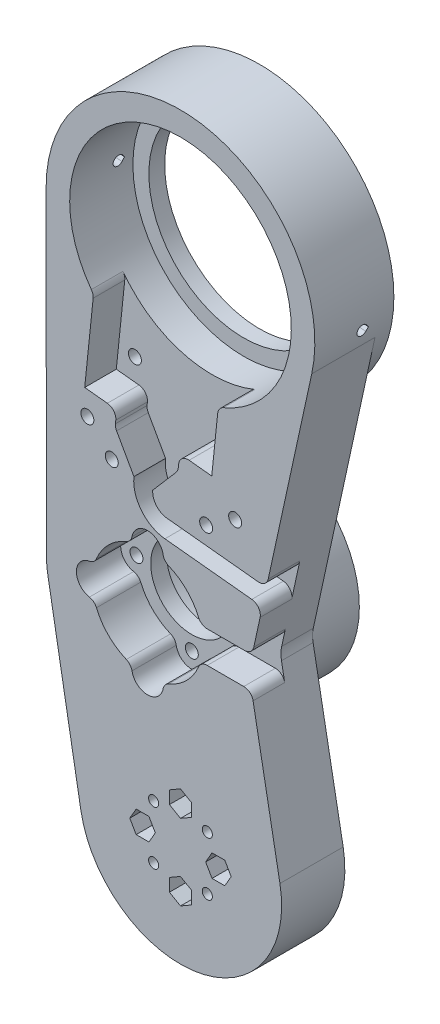
from build123d import *

# Parameters (mm, degrees)
MAIN_R                    = 25
MAIN_R_2                  = 35.05
MAIN_R_3                  = 2.05
BOSS_EXTRUDE10_DEPTH      = 20
BOSS_EXTRUDE11_START      = 6
MAIN_18_R                 = 25
BOSS_EXTRUDE11_DEPTH      = 14
BOSS_EXTRUDE12_START      = 1
MAIN_19_R                 = 25
MAIN_19_R_2               = 2.05
MAIN_19_R_3               = 13
BOSS_EXTRUDE12_DEPTH      = 5
BOSS_EXTRUDE13_START      = -15
MAIN_20_R                 = 32
MAIN_20_R_2               = 25
BOSS_EXTRUDE13_DEPTH      = 15
BOSS_EXTRUDE14_START      = -5
MAIN_21_R                 = 42.5
MAIN_21_R_2               = 35.05
MAIN_21_R_3               = 30
BOSS_EXTRUDE14_DEPTH      = 5
MAIN_24_R                 = 16.25
CUT_EXTRUDE1_DEPTH        = 3.5
SKETCH1_R                 = 2.05
SKETCH1_R_2               = 1.6
CUT_EXTRUDE2_DEPTH        = 7
CUT_EXTRUDE3_OUTLINE_R    = 1.6
CUT_EXTRUDE3_DEPTH        = 13
CUT_EXTRUDE4_START        = -10
CUT_EXTRUDE4_DEPTH        = 10
CUT_EXTRUDE5_START        = -10
SKETCH2_12_R              = 2.05
CUT_EXTRUDE5_DEPTH        = 7
CUT_EXTRUDE6_START        = -17
SKETCH2_13_R              = 1.6
CUT_EXTRUDE6_DEPTH        = 7
BOSS_EXTRUDE15_DEPTH      = 10
INTERSECT1_START          = 10
INTERSECT1_DEPTH          = 10
FILLET1_R                 = 3
CUT_EXTRUDE8_DEPTH        = 10
FILLET3_R                 = 3
FILLET4_R                 = 3.25
CUT_EXTRUDE10_DEPTH       = 13
CUT_EXTRUDE11_REACH       = 209.298
SKETCH6_R                 = 1.6
CUT_EXTRUDE12_START       = -2.75
CUT_EXTRUDE12_OUTLINE_W   = 5.5
CUT_EXTRUDE12_OUTLINE_H   = 3.5
CUT_EXTRUDE12_DEPTH       = 5.5
CUT_EXTRUDE12_START_2     = -14.75
CUT_EXTRUDE12_2_OUTLINE_W = 5.5
CUT_EXTRUDE12_2_OUTLINE_H = 3.5
CUT_EXTRUDE12_2_DEPTH     = 5.5
CUT_EXTRUDE12_START_3     = 9.25
CUT_EXTRUDE12_3_OUTLINE_W = 5.5
CUT_EXTRUDE12_3_OUTLINE_H = 3.5
CUT_EXTRUDE12_3_DEPTH     = 5.5
SKETCH4_R                 = 2.05
CUT_EXTRUDE13_DEPTH       = 7
CUT_EXTRUDE14_OUTLINE_R   = 1.6
CUT_EXTRUDE14_DEPTH       = 13
FILLET5_R                 = 10
CUT_EXTRUDE15_START       = -12.6
CUT_EXTRUDE15_DEPTH       = 12.6
CUT_EXTRUDE16_DEPTH       = 220.84129926
CUT_EXTRUDE16_DEPTH_BACK  = 220.84129926


# Read off the part's stored shape, not the designer's step: Cut-Extrude3, Intersect1, Cut-Extrude12, Cut-Extrude14
with BuildPart() as part:
    # Main → Boss-Extrude10 (new body)
    with BuildSketch(Plane(origin=(0, 0, 0), x_dir=(0, 1, 0), z_dir=(0, 0, 1))):
        with BuildLine():
            ThreePointArc((-5.556741685, 31.513848096), (-31.488658149, -5.697754643), (5.838653427, -31.462837224))
            Line((5.838653427, -31.462837224), (59.088465181, -21.58110934))
            Line((59.088465181, -21.58110934), (150.490078089, -41.523179331))
            ThreePointArc((150.490078089, -41.523179331), (201.806560384, -4.538974444), (159.515320714, 42.499986147))
            Line((159.515320714, 42.499986147), (59.062628257, 42.41888023))
            ThreePointArc((59.062628257, 42.41888023), (56.286612336, 42.295992483), (53.531723495, 41.932738756))
            Line((53.531723495, 41.932738756), (-5.556741685, 31.513848096))
        make_face()
        with Locations(Location((59.088465181, 10.41889066, 0), (0, 0, 270))):
            Circle(MAIN_R, mode=Mode.SUBTRACT)
        with Locations(Location((159.549635378, 0, 0), (0, 0, 270))):
            Circle(MAIN_R_2, mode=Mode.SUBTRACT)
        with Locations(Location((0, 12, 0), (0, 0, 270))):
            Circle(MAIN_R_3, mode=Mode.SUBTRACT)
        with Locations(Location((0, -12, 0), (0, 0, 270))):
            Circle(MAIN_R_3, mode=Mode.SUBTRACT)
        with Locations(Location((-12, 0, 0), (0, 0, 270))):
            Circle(MAIN_R_3, mode=Mode.SUBTRACT)
        with Locations(Location((12, 0, 0), (0, 0, 270))):
            Circle(MAIN_R_3, mode=Mode.SUBTRACT)
    extrude(amount=BOSS_EXTRUDE10_DEPTH)

    # Main<18> → Boss-Extrude11 (add)
    with BuildSketch(Plane(origin=(0, 0, 0), x_dir=(0, 1, 0), z_dir=(0, 0, 1)).offset(BOSS_EXTRUDE11_START)):
        with Locations(Location((59.088465181, 10.41889066, 0), (0, 0, 270))):
            Circle(MAIN_18_R)
        with BuildLine():
            ThreePointArc((64.037181774, 27.204604946), (71.462833851, 22.793259331), (75.874179466, 15.367607253))
            ThreePointArc((75.874179466, 15.367607253), (81.588465181, 10.41889066), (75.874179466, 5.470174067))
            ThreePointArc((75.874179466, 5.470174067), (71.462833851, -1.955478011), (64.037181774, -6.366823626))
            ThreePointArc((64.037181774, -6.366823626), (59.088465181, -12.08110934), (54.139748588, -6.366823626))
            ThreePointArc((54.139748588, -6.366823626), (46.71409651, -1.955478011), (42.302750895, 5.470174067))
            ThreePointArc((42.302750895, 5.470174067), (36.588465181, 10.41889066), (42.302750895, 15.367607253))
            ThreePointArc((42.302750895, 15.367607253), (46.71409651, 22.793259331), (54.139748588, 27.204604946))
            ThreePointArc((54.139748588, 27.204604946), (59.088465181, 32.91889066), (64.037181774, 27.204604946))
        make_face(mode=Mode.SUBTRACT)
    extrude(amount=BOSS_EXTRUDE11_DEPTH)

    # Main<19> → Boss-Extrude12 (add)
    with BuildSketch(Plane(origin=(0, 0, 0), x_dir=(0, 1, 0), z_dir=(0, 0, 1)).offset(BOSS_EXTRUDE12_START)):
        with Locations(Location((59.088465181, 10.41889066, 0), (0, 0, 270))):
            Circle(MAIN_19_R)
        with Locations(Location((59.088465181, -7.08110934, 0), (0, 0, 270))):
            Circle(MAIN_19_R_2, mode=Mode.SUBTRACT)
        with Locations(Location((41.588465181, 10.41889066, 0), (0, 0, 270))):
            Circle(MAIN_19_R_2, mode=Mode.SUBTRACT)
        with Locations(Location((59.088465181, 10.41889066, 0), (0, 0, 270))):
            Circle(MAIN_19_R_3, mode=Mode.SUBTRACT)
        with Locations(Location((76.588465181, 10.41889066, 0), (0, 0, 270))):
            Circle(MAIN_19_R_2, mode=Mode.SUBTRACT)
        with Locations(Location((59.088465181, 27.91889066, 0), (0, 0, 270))):
            Circle(MAIN_19_R_2, mode=Mode.SUBTRACT)
    extrude(amount=BOSS_EXTRUDE12_DEPTH)

    # Main<20> → Boss-Extrude13 (add)
    with BuildSketch(Plane(origin=(0, 0, 0), x_dir=(0, 1, 0), z_dir=(0, 0, 1)).offset(BOSS_EXTRUDE13_START)):
        with Locations(Location((59.088465181, 10.41889066, 0), (0, 0, 270))):
            Circle(MAIN_20_R)
        with Locations(Location((59.088465181, 10.41889066, 0), (0, 0, 270))):
            Circle(MAIN_20_R_2, mode=Mode.SUBTRACT)
    extrude(amount=BOSS_EXTRUDE13_DEPTH)

    # Main<21> → Boss-Extrude14 (add)
    # profile 1 of 2: a face of its own
    with BuildSketch(Plane(origin=(0, 0, 0), x_dir=(0, 1, 0), z_dir=(0, 0, 1)).offset(BOSS_EXTRUDE14_START)):
        with Locations(Location((159.549635378, 0, 0), (0, 0, 90.046260838))):
            Circle(MAIN_21_R)
        with Locations(Location((159.549635378, 0, 0), (0, 0, 270))):
            Circle(MAIN_21_R_2, mode=Mode.SUBTRACT)
    # profile 2 of 2: a face of its own
    with BuildSketch(Plane(origin=(0, 0, 0), x_dir=(0, 1, 0), z_dir=(0, 0, 1)).offset(BOSS_EXTRUDE14_START)):
        with Locations(Location((159.549635378, 0, 0), (0, 0, 270))):
            Circle(MAIN_21_R_2)
        with Locations(Location((159.549635378, 0, 0), (0, 0, 270))):
            Circle(MAIN_21_R_3, mode=Mode.SUBTRACT)
    extrude(amount=BOSS_EXTRUDE14_DEPTH)

    # Main<24> → Cut-Extrude1 (cut)
    with BuildSketch(Plane(origin=(0, 0, 0), x_dir=(0, 1, 0), z_dir=(0, 0, 1))):
        with Locations(Location((0, 0, 0), (0, 0, 270))):
            Circle(MAIN_24_R)
    extrude(amount=CUT_EXTRUDE1_DEPTH, mode=Mode.SUBTRACT)

    # Sketch1 → Cut-Extrude2 (cut)
    # profile 1 of 4: a face of its own
    with BuildSketch(Plane.XY.offset(20)):
        with Locations((-29.460911372, 103.288594674)):
            Circle(SKETCH1_R)
        with Locations((-29.460911372, 103.288594674)):
            Circle(SKETCH1_R_2, mode=Mode.SUBTRACT)
    # profile 2 of 4: a face of its own
    with BuildSketch(Plane.XY.offset(20)):
        with Locations((-29.460911372, 103.288594674)):
            Circle(SKETCH1_R_2)
    # profile 3 of 4: a face of its own
    with BuildSketch(Plane.XY.offset(20)):
        with Locations((17.288346046, 98.44020001)):
            Circle(SKETCH1_R)
        with Locations((17.288346046, 98.44020001)):
            Circle(SKETCH1_R_2, mode=Mode.SUBTRACT)
    # profile 4 of 4: a face of its own
    with BuildSketch(Plane.XY.offset(20)):
        with Locations((17.288346046, 98.44020001)):
            Circle(SKETCH1_R_2)
    extrude(amount=-CUT_EXTRUDE2_DEPTH, mode=Mode.SUBTRACT)

    # Cut-Extrude3 outline → Cut-Extrude3 (cut)
    with BuildSketch(Plane.XY):
        with Locations((17.288346046, 98.44020001)):
            Circle(CUT_EXTRUDE3_OUTLINE_R)
        with Locations((-29.460911372, 103.288594674)):
            Circle(CUT_EXTRUDE3_OUTLINE_R)
    extrude(amount=CUT_EXTRUDE3_DEPTH, mode=Mode.SUBTRACT)

    # Sketch2 → Cut-Extrude4 (cut)
    with BuildSketch(Plane.XY.offset(20).offset(CUT_EXTRUDE4_START)):
        with BuildLine():
            Line((-29.586429257, 117.712405115), (-27.501094437, 137.819649074))
            ThreePointArc((-27.501094437, 137.819649074), (-9.587027237, 125.836264013), (11.952039535, 126.600413066))
            Line((11.952039535, 126.600413066), (10.598038822, 113.544848851))
            Line((10.598038822, 113.544848851), (9.886253223, 106.681659996))
            Line((9.886253223, 106.681659996), (-0.259330302, 107.733864795))
            Line((-0.259330302, 107.733864795), (-20.152631332, 109.797011461))
            Line((-20.152631332, 109.797011461), (-30.298214856, 110.84921626))
            Line((-30.298214856, 110.84921626), (-29.586429257, 117.712405115))
        make_face()
    extrude(amount=CUT_EXTRUDE4_DEPTH, mode=Mode.SUBTRACT)

    # Sketch2<12> → Cut-Extrude5 (cut)
    with BuildSketch(Plane.XY.offset(20).offset(CUT_EXTRUDE5_START)):
        with Locations((-24.414170989, 117.175986982)):
            Circle(SKETCH2_12_R)
        with Locations((5.425780554, 114.081266984)):
            Circle(SKETCH2_12_R)
    extrude(amount=-CUT_EXTRUDE5_DEPTH, mode=Mode.SUBTRACT)

    # Sketch2<13> → Cut-Extrude6 (cut)
    with BuildSketch(Plane.XY.offset(20).offset(CUT_EXTRUDE6_START)):
        with Locations((-24.414170989, 117.175986982)):
            Circle(SKETCH2_13_R)
        with Locations((5.425780554, 114.081266984)):
            Circle(SKETCH2_13_R)
    extrude(amount=-CUT_EXTRUDE6_DEPTH, mode=Mode.SUBTRACT)


with BuildPart() as body_2:
    # Sketch3 → Boss-Extrude15 (new body)
    with BuildSketch(Plane.XY.offset(20)):
        with BuildLine():
            Line((-0.259330302, 107.733864795), (-20.152631332, 109.797011461))
            Line((-20.152631332, 109.797011461), (-20.668417998, 104.823686203))
            Line((-20.668417998, 104.823686203), (-14.730087986, 94.218257585))
            ThreePointArc((-14.730087986, 94.218257585), (-11.412187952, 96.82600169), (-8.769345662, 93.535990356))
            ThreePointArc((-8.769345662, 93.535990356), (-8.772457879, 93.505043934), (-8.775377534, 93.474078752))
            Line((-8.775377534, 93.474078752), (-0.775116969, 102.760539538))
            Line((-0.775116969, 102.760539538), (-0.259330302, 107.733864795))
        make_face()
        with BuildLine():
            ThreePointArc((-8.769345662, 93.535990356), (-11.412187952, 96.82600169), (-14.730087986, 94.218257585))
            ThreePointArc((-14.730087986, 94.218257585), (-14.73388015, 94.186615219), (-14.73733597, 94.154934356))
            ThreePointArc((-14.73733597, 94.154934356), (-12.335074585, 86.085901007), (-4.93075107, 82.078888124))
            ThreePointArc((-4.93075107, 82.078888124), (-1.637283916, 84.753411278), (-4.311807071, 88.046878433))
            ThreePointArc((-4.311807071, 88.046878433), (-7.657726913, 89.84416483), (-8.775377534, 93.474078752))
            ThreePointArc((-8.775377534, 93.474078752), (-8.772457879, 93.505043934), (-8.769345662, 93.535990356))
        make_face()
        with BuildLine():
            Line((27.186542959, 84.780164892), (-4.311807071, 88.046878433))
            ThreePointArc((-4.311807071, 88.046878433), (-1.637283916, 84.753411278), (-4.93075107, 82.078888124))
            Line((-4.93075107, 82.078888124), (25.899558705, 78.881457455))
            Line((25.899558705, 78.881457455), (27.186542959, 84.780164892))
        make_face()
    extrude(amount=-BOSS_EXTRUDE15_DEPTH)


with BuildPart() as intersect1_tool:
    # Intersect1 outline → Intersect1 (new body)
    with BuildSketch(Plane.XY.offset(INTERSECT1_START)):
        with BuildLine():
            Line((-4.93075107, 82.078888124), (25.899558705, 78.881457455))
            Line((25.899558705, 78.881457455), (27.186542959, 84.780164892))
            Line((27.186542959, 84.780164892), (-4.311807071, 88.046878433))
            ThreePointArc((-4.311807071, 88.046878433), (-7.657726913, 89.844164831), (-8.775377534, 93.474078752))
            Line((-8.775377534, 93.474078752), (-0.775116969, 102.760539538))
            Line((-0.775116969, 102.760539538), (-0.259330302, 107.733864795))
            Line((-0.259330302, 107.733864795), (-20.152631332, 109.797011461))
            Line((-20.152631332, 109.797011461), (-20.668417998, 104.823686203))
            Line((-20.668417998, 104.823686203), (-14.730087986, 94.218257585))
            ThreePointArc((-14.730087986, 94.218257585), (-14.73388015, 94.186615219), (-14.73733597, 94.154934356))
            ThreePointArc((-14.73733597, 94.154934356), (-12.335074585, 86.085901007), (-4.93075107, 82.078888124))
        make_face()
    extrude(amount=INTERSECT1_DEPTH)


with BuildPart() as part_1:
    add(part.part)

    # Intersect1: cut by intersect1_tool
    add(intersect1_tool.part, mode=Mode.SUBTRACT)

    # Fillet1
    fillet1_edges = [part_1.edges().sort_by_distance(p)[0] for p in [
        (-27.501094437, 137.819649074, 15),
        (11.952039535, 126.600413066, 15),
        (-0.259330302, 107.733864795, 15),
        (25.899558705, 78.881457455, 15),
        (27.186542959, 84.780164892, 15),
        (-20.152631332, 109.797011461, 15),
        (-20.668417998, 104.823686203, 15),
        (-0.775116969, 102.760539538, 15),
    ]]
    fillet(fillet1_edges, radius=FILLET1_R)

    # Sketch5 → Cut-Extrude8 (cut)
    with BuildSketch(Plane.XY.offset(20)):
        Polygon((22.672012955, 64.088465181), (21.58110934, 59.088465181), (22.508974393, 54.088465181), (5.08110934, 54.088465181), (5.08110934, 64.088465181), align=None)
    extrude(amount=-CUT_EXTRUDE8_DEPTH, mode=Mode.SUBTRACT)

    # Fillet3
    # the kernel refuses this fillet: 3 mm, written as the material it takes off along each edge
    with BuildSketch(Plane(origin=(-15.367607253, 75.874179466, 6), x_dir=(0.018092404043588525, 0.999836319062237, 0), z_dir=(0, 0, 1)), Plane(origin=(-5.470174067, 42.302750895, 6), x_dir=(-0.018092404043595627, -0.9998363190622368, 0), z_dir=(0, 0, 1)), Plane(origin=(-27.204604946, 54.139748588, 6), x_dir=(-0.9998363190622368, 0.018092404043601663, 0), z_dir=(0, 0, 1))) as fillet3_piece_1:
        with BuildLine():
            CenterArc((2.089627747, 2.960990062), FILLET3_R, 203.616579082, 57.133535261)
            ThreePointArc((-0.659112793, 1.75914754), (-0.305934486, 0.888424365), (0, 0))
            ThreePointArc((0, 0), (0.803702979, 0.065016563), (1.607405959, 0))
        make_face()
    extrude(amount=18.696427991, mode=Mode.SUBTRACT)
    with BuildSketch(Plane(origin=(-5.470174067, 75.874179466, 6), x_dir=(0.9426230632930025, -0.3338588931691295, 0), z_dir=(0, 0, 1)), Plane(origin=(-15.367607253, 42.302750895, 6), x_dir=(-0.9426230632930039, 0.3338588931691254, 0), z_dir=(0, 0, 1)), Plane(origin=(-27.204604946, 64.037181774, 6), x_dir=(0.33385889316913303, 0.9426230632930012, 0), z_dir=(0, 0, 1))) as fillet3_piece_2:
        with BuildLine():
            CenterArc((2.039591585, 2.995675622), FILLET3_R, 209.789723377, 57.133535261)
            ThreePointArc((-0.563972147, 1.505220693), (-0.221102713, 0.775421964), (0, 0))
            ThreePointArc((0, 0), (0.939285598, 0.025225536), (1.878571196, 0))
        make_face()
    extrude(amount=18.696427991, mode=Mode.SUBTRACT)
    with BuildSketch(Plane(origin=(6.351619171, 54.088465181, 25.260190642), x_dir=(-0.33850165532610416, -0.9409657960529104, 0), z_dir=(0, 0, -1))) as fillet3_piece_3:
        with BuildLine():
            CenterArc((2.110664092, -2.995368756), FILLET3_R, 93.184063487, 67.030323428)
            Line((-0.712233296, -1.97986379), (0, 0))
            ThreePointArc((0, 0), (0.972016358, -0.02701559), (1.944032717, 0))
        make_face()
    extrude(amount=15.260190642, mode=Mode.SUBTRACT)
    with BuildSketch(Plane(origin=(6.351619171, 64.088465181, 25.260190642), x_dir=(1, 0, 0), z_dir=(0, 0, -1))) as fillet3_piece_4:
        with BuildLine():
            CenterArc((2.104076257, -3), FILLET3_R, 90, 67.030323428)
            ThreePointArc((-0.658058293, -1.829268293), (-0.3036084, -0.923778968), (0, 0))
            Line((0, 0), (2.104076257, 0))
        make_face()
    extrude(amount=15.260190642, mode=Mode.SUBTRACT)
    with BuildSketch(Plane(origin=(22.508974393, 54.088465181, 26.236249385), x_dir=(-1, 0, 0), z_dir=(0, 0, -1))) as fillet3_piece_5:
        with BuildLine():
            CenterArc((FILLET3_R * 0.831499918045, -FILLET3_R), FILLET3_R, 90, 79.487040481)
            Line((-FILLET3_R * 0.151713745192, -FILLET3_R * 0.817542080402), (0, 0))
            Line((0, 0), (FILLET3_R * 0.831499918045, 0))
        make_face()
    extrude(amount=16.236249385, mode=Mode.SUBTRACT)
    with BuildSketch(Plane(origin=(22.672012955, 64.088465181, 26.040079887), x_dir=(-1, 0, 0), z_dir=(0, 0, -1))) as fillet3_piece_6:
        with BuildLine():
            CenterArc((FILLET3_R * 0.805343984975, FILLET3_R), FILLET3_R, 192.307955921, 77.692044079)
            Line((-FILLET3_R * 0.171671999276, FILLET3_R * 0.786833946142), (0, 0))
            Line((0, 0), (FILLET3_R * 0.805343984975, 0))
        make_face()
    extrude(amount=16.040079887, mode=Mode.SUBTRACT)

    # Fillet4
    fillet4_edges = [part_1.edges().sort_by_distance(p)[0] for p in [
        (6.366823626, 54.139748588, 8),
        (6.366823626, 64.037181774, 8),
    ]]
    fillet(fillet4_edges, radius=FILLET4_R)

    # Sketch7 → Cut-Extrude10 (cut)
    with BuildSketch(Plane.XY.offset(20)):
        Polygon((0, 7.958548116), (3.5, 9.979274058), (3.5, 14.020725942), (0, 16.041451884), (-3.5, 14.020725942), (-3.5, 9.979274058), align=None)
        Polygon((-7.958548116, 0), (-9.979274058, 3.5), (-14.020725942, 3.5), (-16.041451884, 0), (-14.020725942, -3.5), (-9.979274058, -3.5), align=None)
        Polygon((7.958548116, 0), (9.979274058, -3.5), (14.020725942, -3.5), (16.041451884, 0), (14.020725942, 3.5), (9.979274058, 3.5), align=None)
        Polygon((0, -7.958548116), (-3.5, -9.979274058), (-3.5, -14.020725942), (0, -16.041451884), (3.5, -14.020725942), (3.5, -9.979274058), align=None)
    extrude(amount=-CUT_EXTRUDE10_DEPTH, mode=Mode.SUBTRACT)

    # Sketch6 → Cut-Extrude11 (cut, up to next)
    with BuildSketch(Plane(origin=(0, 0, 3.5), x_dir=(1, 0, 0), z_dir=(0, 0, -1)), mode=Mode.PRIVATE) as cut_extrude11_sk1:
        with Locations(Location((8.485281374, -8.485281374, 0), (0, 0, 180))):
            Circle(SKETCH6_R)
    cut_extrude11_tool1 = extrude(cut_extrude11_sk1.sketch, amount=-CUT_EXTRUDE11_REACH, mode=Mode.PRIVATE) & part_1.part
    # Sketch6 → Cut-Extrude11 (cut, up to next)
    with BuildSketch(Plane(origin=(0, 0, 3.5), x_dir=(1, 0, 0), z_dir=(0, 0, -1)), mode=Mode.PRIVATE) as cut_extrude11_sk2:
        with Locations(Location((-8.485281374, -8.485281374, 0), (0, 0, 180))):
            Circle(SKETCH6_R)
    cut_extrude11_tool2 = extrude(cut_extrude11_sk2.sketch, amount=-CUT_EXTRUDE11_REACH, mode=Mode.PRIVATE) & part_1.part
    # Sketch6 → Cut-Extrude11 (cut, up to next)
    with BuildSketch(Plane(origin=(0, 0, 3.5), x_dir=(1, 0, 0), z_dir=(0, 0, -1)), mode=Mode.PRIVATE) as cut_extrude11_sk3:
        with Locations(Location((-8.485281374, 8.485281374, 0), (0, 0, 180))):
            Circle(SKETCH6_R)
    cut_extrude11_tool3 = extrude(cut_extrude11_sk3.sketch, amount=-CUT_EXTRUDE11_REACH, mode=Mode.PRIVATE) & part_1.part
    # Sketch6 → Cut-Extrude11 (cut, up to next)
    with BuildSketch(Plane(origin=(0, 0, 3.5), x_dir=(1, 0, 0), z_dir=(0, 0, -1)), mode=Mode.PRIVATE) as cut_extrude11_sk4:
        with Locations(Location((8.485281374, 8.485281374, 0), (0, 0, 180))):
            Circle(SKETCH6_R)
    cut_extrude11_tool4 = extrude(cut_extrude11_sk4.sketch, amount=-CUT_EXTRUDE11_REACH, mode=Mode.PRIVATE) & part_1.part
    add(cut_extrude11_tool1.solids().sort_by_distance((8.485281, 8.485281, 3.5))[0], mode=Mode.SUBTRACT)
    add(cut_extrude11_tool2.solids().sort_by_distance((-8.485281, 8.485281, 3.5))[0], mode=Mode.SUBTRACT)
    add(cut_extrude11_tool3.solids().sort_by_distance((-8.485281, -8.485281, 3.5))[0], mode=Mode.SUBTRACT)
    add(cut_extrude11_tool4.solids().sort_by_distance((8.485281, -8.485281, 3.5))[0], mode=Mode.SUBTRACT)

    # Cut-Extrude12 outline → Cut-Extrude12 (cut)
    with BuildSketch(Plane(origin=(0, 0, 0), x_dir=(0.7071067811865474, -0.7071067811865477, 0), z_dir=(0.7071067811865476, 0.7071067811865476, 0)).offset(CUT_EXTRUDE12_START)):
        with Locations((12, -5.25)):
            Rectangle(CUT_EXTRUDE12_OUTLINE_W, CUT_EXTRUDE12_OUTLINE_H)
        with Locations((-12, -5.25)):
            Rectangle(CUT_EXTRUDE12_OUTLINE_W, CUT_EXTRUDE12_OUTLINE_H)
    extrude(amount=CUT_EXTRUDE12_DEPTH, mode=Mode.SUBTRACT)

    # Cut-Extrude12 2 outline → Cut-Extrude12 2 (cut)
    with BuildSketch(Plane(origin=(0, 0, 0), x_dir=(0.7071067811865474, -0.7071067811865477, 0), z_dir=(0.7071067811865476, 0.7071067811865476, 0)).offset(CUT_EXTRUDE12_START_2)):
        with Locations((0, -5.25)):
            Rectangle(CUT_EXTRUDE12_2_OUTLINE_W, CUT_EXTRUDE12_2_OUTLINE_H)
    extrude(amount=CUT_EXTRUDE12_2_DEPTH, mode=Mode.SUBTRACT)

    # Cut-Extrude12 3 outline → Cut-Extrude12 3 (cut)
    with BuildSketch(Plane(origin=(0, 0, 0), x_dir=(0.7071067811865474, -0.7071067811865477, 0), z_dir=(0.7071067811865476, 0.7071067811865476, 0)).offset(CUT_EXTRUDE12_START_3)):
        with Locations((0, -5.25)):
            Rectangle(CUT_EXTRUDE12_3_OUTLINE_W, CUT_EXTRUDE12_3_OUTLINE_H)
    extrude(amount=CUT_EXTRUDE12_3_DEPTH, mode=Mode.SUBTRACT)

    # Sketch4 → Cut-Extrude13 (cut)
    with BuildSketch(Plane.XY.offset(20)):
        with Locations((-21.728359768, 95.449101981)):
            Circle(SKETCH4_R)
        with Locations((8.111591776, 92.354381983)):
            Circle(SKETCH4_R)
    extrude(amount=-CUT_EXTRUDE13_DEPTH, mode=Mode.SUBTRACT)

    # Cut-Extrude14 outline → Cut-Extrude14 (cut)
    with BuildSketch(Plane.XY):
        with Locations((-21.728359768, 95.449101981)):
            Circle(CUT_EXTRUDE14_OUTLINE_R)
        with Locations((8.111591776, 92.354381983)):
            Circle(CUT_EXTRUDE14_OUTLINE_R)
    extrude(amount=CUT_EXTRUDE14_DEPTH, mode=Mode.SUBTRACT)

    # Fillet5
    # the kernel refuses this fillet: 10 mm, written as the material it adds along each edge
    with BuildSketch(Plane(origin=(21.58110934, 59.088465181, 0), x_dir=(0.2131660538584211, 0.9770159842512449, 0), z_dir=(0, 0, 1))) as fillet5_piece_1:
        with BuildLine():
            CenterArc((FILLET5_R * 0.201825318765, -FILLET5_R), FILLET5_R, 90, 22.82091544)
            Line((-FILLET5_R * 0.186026761828, -FILLET5_R * 0.0782783697991), (0, 0))
            Line((0, 0), (FILLET5_R * 0.201825318765, 0))
        make_face()
    extrude(amount=10)

    # Sketch11 → Cut-Extrude15 (cut)
    with BuildSketch(Plane(origin=(0, 0, -5), x_dir=(1, 0, 0), z_dir=(0, 0, -1)).offset(CUT_EXTRUDE15_START)):
        Polygon((37.498115689, -152.745128065), (38.096428222, -158.514185363), (40.085758325, -158.307870697), (39.487445792, -152.538813398), align=None)
        Polygon((-40.085758325, -160.79140006), (-39.487445792, -166.560457358), (-37.498115689, -166.354142691), (-38.096428222, -160.585085393), align=None)
    extrude(amount=CUT_EXTRUDE15_DEPTH, mode=Mode.SUBTRACT)

    # Sketch12 → Cut-Extrude16 (cut, two sides: drawn at the far end of the back side and taken through both)
    with BuildSketch(Plane(origin=(-54.168180468, 5.617815803, 0), x_dir=(-0.10315733326748301, -0.9946650514586011, 0), z_dir=(-0.9946650514586011, 0.10315733326748301, 0)).offset(-CUT_EXTRUDE16_DEPTH_BACK)):
        with BuildLine():
            Line((-158.698446284, 2.85), (-157.738446284, 3.57))
            ThreePointArc((-157.738446284, 3.57), (-158.698446284, 6.45), (-159.658446284, 3.57))
            Line((-159.658446284, 3.57), (-158.698446284, 2.85))
        make_face()
    extrude(amount=CUT_EXTRUDE16_DEPTH + CUT_EXTRUDE16_DEPTH_BACK, mode=Mode.SUBTRACT)


with BuildPart() as body_2_1:
    add(body_2.part)

    # Intersect1: cut by intersect1_tool
    add(intersect1_tool.part, mode=Mode.SUBTRACT)


solid = part_1.part
